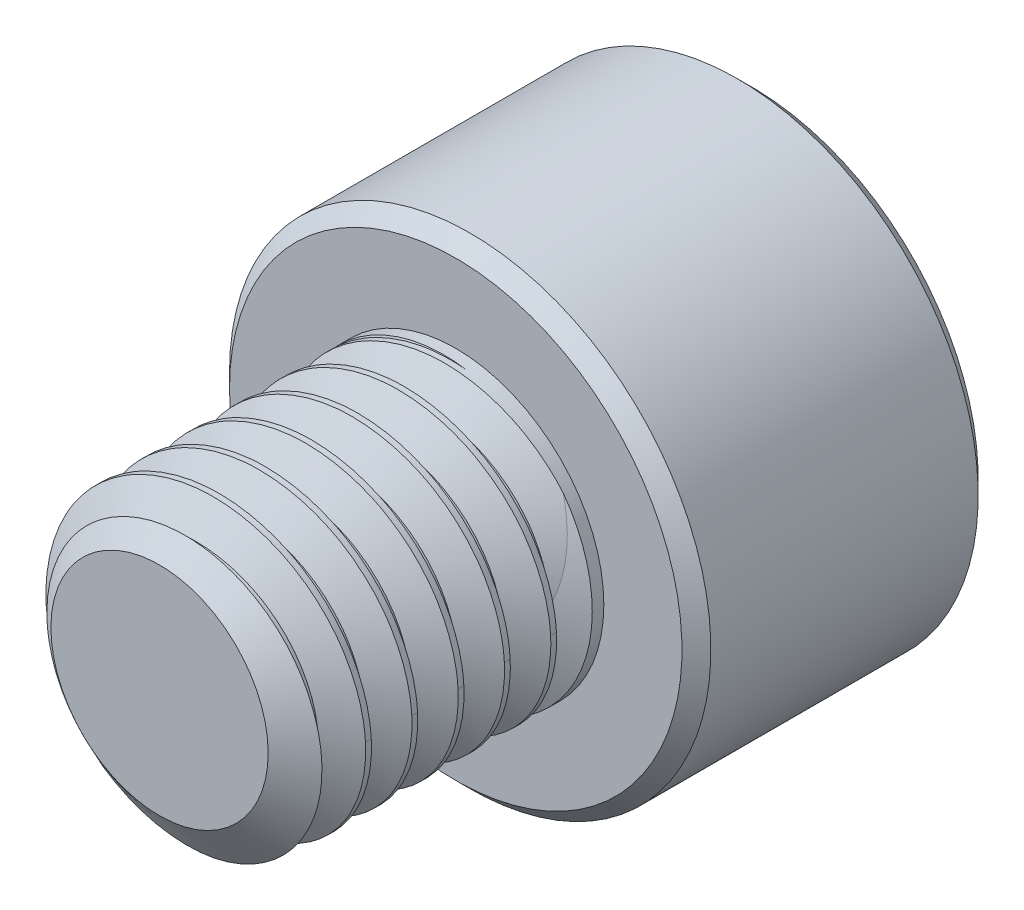
from build123d import *

# Parameters (mm, degrees)
SKETCH1_R          = 4
EXTRUDE1_DEPTH     = 8
CUT_SWEEP1_PITCH   = 1.25
SKETCH6_R          = 6.5
EXTRUDE2_DEPTH     = 8
CUT_EXTRUDE1_DEPTH = 4.5
CHAMFER1_SIZE      = 0.39


with BuildPart() as part:
    # Sketch1 → Extrude1 (new body)
    with BuildSketch(Plane.XY):
        Circle(SKETCH1_R)
    extrude(amount=-EXTRUDE1_DEPTH)

    # Cut-Sweep1: the profile of Sketch3 profile screwed along a right-hand helix of 7.4 turns, 6 arcs to a turn; built about Z, then put on its axis
    cut_sweep1_z = Axis((0, 0, 0), (0, 0, 1))
    cut_sweep1_corners = [(4.0003, 0, -1.093923205), (3.188101184, 0, -0.625), (3.188101184, 0, -0.46875), (4.0003, 0, 0.000173205)]
    with BuildLine(mode=Mode.PRIVATE) as cut_sweep1_profile:
        Line(cut_sweep1_corners[0], cut_sweep1_corners[1])
        Line(cut_sweep1_corners[1], cut_sweep1_corners[2])
        Line(cut_sweep1_corners[2], cut_sweep1_corners[3])
        Line(cut_sweep1_corners[3], cut_sweep1_corners[0])
    cut_sweep1_cap = Face(cut_sweep1_profile.wire())
    cut_sweep1_turn_angles = [0, 30, 60, 90, 120, 150, 180, 210, 240, 270, 300, 330, 360]
    cut_sweep1_turn_weights = [1, 0.8660254037844387, 1, 0.8660254037844387, 1, 0.8660254037844387, 1, 0.8660254037844387, 1, 0.8660254037844387, 1, 0.8660254037844387, 1]
    cut_sweep1_turn_rails = [Edge.make_bspline([Vector(p[0], p[1], 0).rotate(cut_sweep1_z, cut_sweep1_turn_angles[k]) / cut_sweep1_turn_weights[k] + Vector(0, 0, p[2] + CUT_SWEEP1_PITCH * cut_sweep1_turn_angles[k] / 360) for k in range(13)], [0, 0, 0, 1, 1, 2, 2, 3, 3, 4, 4, 5, 5, 6, 6, 6], 2, cut_sweep1_turn_weights) for p in cut_sweep1_corners]
    cut_sweep1_turn_sides = [Face.make_surface_from_curves(cut_sweep1_turn_rails[p[0]], cut_sweep1_turn_rails[p[1]]) for p in [(0, 1), (1, 2), (2, 3), (3, 0)]]
    cut_sweep1_last_angles = [2520, 2550, 2580, 2610, 2640, 2652, 2664]
    cut_sweep1_last_weights = [1, 0.8660254037844387, 1, 0.8660254037844387, 1, 0.9781476007337957, 1]
    cut_sweep1_last_rails = [Edge.make_bspline([Vector(p[0], p[1], 0).rotate(cut_sweep1_z, cut_sweep1_last_angles[k]) / cut_sweep1_last_weights[k] + Vector(0, 0, p[2] + CUT_SWEEP1_PITCH * cut_sweep1_last_angles[k] / 360) for k in range(7)], [0, 0, 0, 1, 1, 2, 2, 3, 3, 3], 2, cut_sweep1_last_weights) for p in cut_sweep1_corners]
    cut_sweep1_last_sides = [Face.make_surface_from_curves(cut_sweep1_last_rails[p[0]], cut_sweep1_last_rails[p[1]]) for p in [(0, 1), (1, 2), (2, 3), (3, 0)]]
    cut_sweep1 = Plane(origin=(0, 0, 0), x_dir=(0, 1, 0), z_dir=(0, 0, -1)) * Solid(Shell([*[p.moved(Location((0, 0, CUT_SWEEP1_PITCH * i))) for i in range(7) for p in cut_sweep1_turn_sides], *cut_sweep1_last_sides, cut_sweep1_cap, cut_sweep1_cap.rotate(cut_sweep1_z, 2664).moved(Location((0, 0, CUT_SWEEP1_PITCH * 2664 / 360)))]))
    add(cut_sweep1, mode=Mode.SUBTRACT)

    # Sketch4 → Cut-Revolve1 (revolve, cut)
    with BuildSketch(Plane(origin=(0, 0, 0), x_dir=(0, 0, -1), z_dir=(1, 0, 0)), mode=Mode.PRIVATE) as cut_revolve1_sk:
        Polygon((0.746350386, 4), (0, 2.934101184), (0, 4), align=None)
    revolve(cut_revolve1_sk.sketch.rotate(Axis((0, 0, 0), (0, 0, -1)), 230.713364492), axis=Axis((0, 0, 0), (0, 0, -1)), mode=Mode.SUBTRACT)

    # Sketch6 → Extrude2 (add)
    with BuildSketch(Plane(origin=(0, 0, -8), x_dir=(-1, 0, 0), z_dir=(0, 0, -1))):
        Circle(SKETCH6_R)
    extrude(amount=EXTRUDE2_DEPTH)

    # Sketch7 → Cut-Extrude1 (cut)
    with BuildSketch(Plane(origin=(0, 0, -16), x_dir=(-1, 0, 0), z_dir=(0, 0, -1))):
        Polygon((0, 3.464101615), (-3, 1.732050808), (-3, -1.732050808), (0, -3.464101615), (3, -1.732050808), (3, 1.732050808), align=None)
    extrude(amount=-CUT_EXTRUDE1_DEPTH, mode=Mode.SUBTRACT)

    # Cut-Extrude2 cone 1 section (through the dimple's axis) → Cut-Extrude2 (revolve, cut)
    with BuildSketch(Plane(origin=(0, 0, -16), x_dir=(0, 1, 0), z_dir=(1, 0, 0))):
        Polygon((0, 0), (3.464101615, 0), (0, 3.464101615), align=None)
    revolve(axis=Axis((0, 0, -16), (0, 0, 1)), mode=Mode.SUBTRACT)

    # Chamfer1
    chamfer1_edges = [part.edges().sort_by_distance(p)[0] for p in [
        (6.5, 0, -8),
        (6.5, 0, -16),
    ]]
    chamfer(chamfer1_edges, length=CHAMFER1_SIZE)

    # Sketch10 → Revolve1 (revolve)
    with BuildSketch(Plane(origin=(0, 0, 0), x_dir=(0, 0, -1), z_dir=(1, 0, 0)), mode=Mode.PRIVATE) as revolve1_sk:
        Polygon((8, 4), (8, 0), (6.030645751, 0), (7.6875, 4), align=None)
    revolve(revolve1_sk.sketch.rotate(Axis((0, 0, -8), (0, 0, 1)), 270), axis=Axis((0, 0, -8), (0, 0, 1)))


solid = part.part
